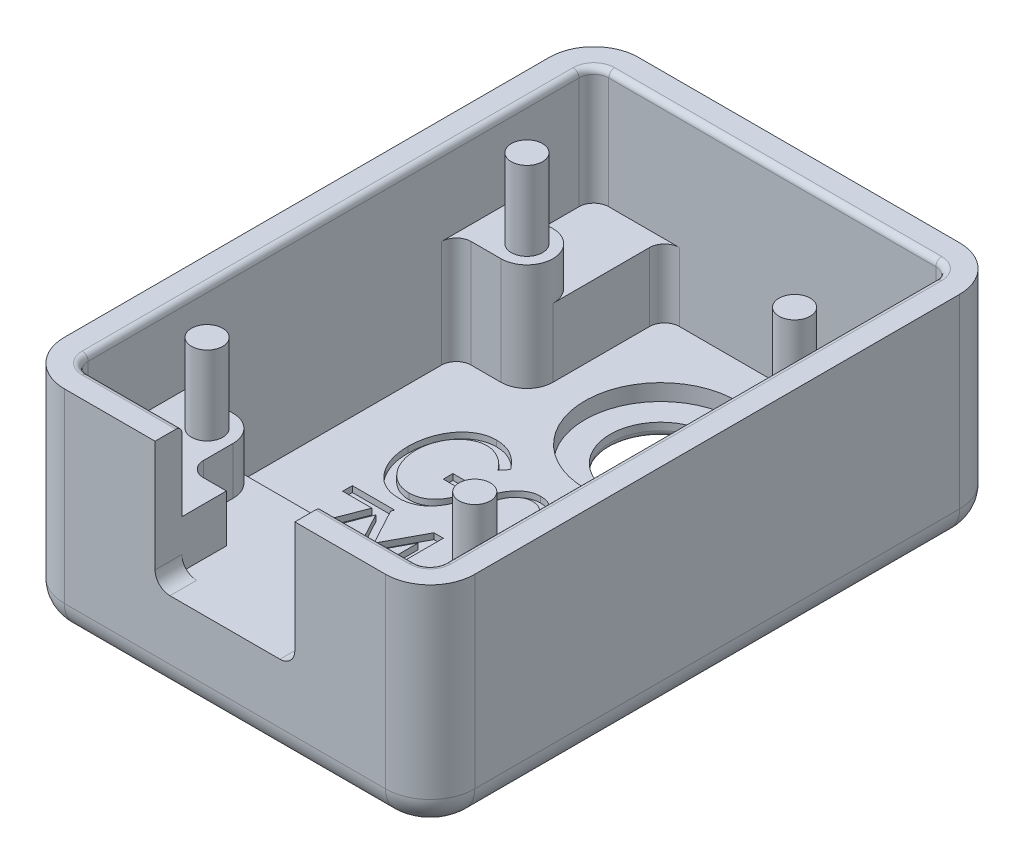
from build123d import *

# Parameters (mm, degrees)
SKETCH_1_3_W        = 27.6
SKETCH_1_3_H        = 38.61
EXTRUDE_2_DEPTH     = 5.3
SKETCH_1_3_R        = 1.05
EXTRUDE_2_2_DEPTH   = 5.3
EXTRUDE_2_3_DEPTH   = 5.3
EXTRUDE_2_4_DEPTH   = 5.3
EXTRUDE_2_5_DEPTH   = 5.3
EXTRUDE_START       = -7.2
SKETCH_1_W          = 27.6
SKETCH_1_H          = 38.61
EXTRUDE_3_DEPTH     = 7.2
EXTRUDE_START_2     = -8.1
EXTRUDE_4_DEPTH     = 4.9
CUT_EXTRUDE_1_DEPTH = 2.3
SKETCH_1_6_W        = 27.6
SKETCH_1_6_H        = 38.61
EXTRUDE_5_DEPTH     = 2
EXTRUDE_6_DEPTH     = 4.6
FILLET_1_R          = 3
FILLET_3_R          = 2
SKETCH_3_7_R        = 3.4
CUT_EXTRUDE_2_DEPTH = 3
SKETCH_3_8_R        = 5.1
SKETCH_3_8_R_2      = 3.4
CUT_EXTRUDE_3_DEPTH = 1.1
FILLET_4_R          = 0.4
FILLET_5_R          = 0.4
CUT_EXTRUDE_4_DEPTH = 0.4
CUT_EXTRUDE_5_DEPTH = 0.4


with BuildPart() as part:
    # 草图1<3> → 凸台-拉伸2 (new body)
    with BuildSketch(Plane(origin=(0, 0, 0), x_dir=(1, 0, 0), z_dir=(0, 1, 0))):
        with Locations((0, 0.75)):
            Rectangle(SKETCH_1_3_W, SKETCH_1_3_H)
        with BuildLine():
            ThreePointArc((-12, 17.255), (-11.707106781, 17.962106781), (-11, 18.255))
            Line((-11, 18.255), (11, 18.255))
            ThreePointArc((11, 18.255), (11.707106781, 17.962106781), (12, 17.255))
            Line((12, 17.255), (12, -15.755))
            ThreePointArc((12, -15.755), (11.707106781, -16.462106781), (11, -16.755))
            Line((11, -16.755), (-11, -16.755))
            ThreePointArc((-11, -16.755), (-11.707106781, -16.462106781), (-12, -15.755))
            Line((-12, -15.755), (-12, 17.255))
        make_face(mode=Mode.SUBTRACT)
    extrude(amount=EXTRUDE_2_DEPTH)

    # 草图1 → 凸台-拉伸3 (add)
    with BuildSketch(Plane(origin=(0, 0, 0), x_dir=(1, 0, 0), z_dir=(0, 1, 0)).offset(EXTRUDE_START)):
        with Locations((0, 0.75)):
            Rectangle(SKETCH_1_W, SKETCH_1_H)
        with BuildLine():
            ThreePointArc((-12, 17.255), (-11.707106781, 17.962106781), (-11, 18.255))
            Line((-11, 18.255), (11, 18.255))
            ThreePointArc((11, 18.255), (11.707106781, 17.962106781), (12, 17.255))
            Line((12, 17.255), (12, 13.505))
            ThreePointArc((12, 13.505), (11.707106781, 12.797893219), (11, 12.505))
            Line((11, 12.505), (9, 12.505))
            ThreePointArc((9, 12.505), (7.25, 10.755), (9, 9.005))
            Line((9, 9.005), (11, 9.005))
            ThreePointArc((11, 9.005), (11.707106781, 8.712106781), (12, 8.005))
            Line((12, 8.005), (12, -8.005))
            ThreePointArc((12, -8.005), (11.707106781, -8.712106781), (11, -9.005))
            Line((11, -9.005), (9, -9.005))
            ThreePointArc((9, -9.005), (7.762563133, -9.517563133), (7.25, -10.755))
            Line((7.25, -10.755), (7.25, -12.755))
            ThreePointArc((7.25, -12.755), (6.957106781, -13.462106781), (6.25, -13.755))
            Line((6.25, -13.755), (4.7, -13.755))
            Line((4.7, -13.755), (4.7, -16.755))
            Line((4.7, -16.755), (-4.7, -16.755))
            Line((-4.7, -16.755), (-4.7, -13.755))
            Line((-4.7, -13.755), (-6.25, -13.755))
            ThreePointArc((-6.25, -13.755), (-6.957106781, -13.462106781), (-7.25, -12.755))
            Line((-7.25, -12.755), (-7.25, -10.755))
            ThreePointArc((-7.25, -10.755), (-7.762563133, -9.517563133), (-9, -9.005))
            Line((-9, -9.005), (-11, -9.005))
            ThreePointArc((-11, -9.005), (-11.707106781, -8.712106781), (-12, -8.005))
            Line((-12, -8.005), (-12, 8.005))
            ThreePointArc((-12, 8.005), (-11.707106781, 8.712106781), (-11, 9.005))
            Line((-11, 9.005), (-9, 9.005))
            ThreePointArc((-9, 9.005), (-7.25, 10.755), (-9, 12.505))
            Line((-9, 12.505), (-11, 12.505))
            ThreePointArc((-11, 12.505), (-11.707106781, 12.797893219), (-12, 13.505))
            Line((-12, 13.505), (-12, 17.255))
        make_face(mode=Mode.SUBTRACT)
    extrude(amount=EXTRUDE_3_DEPTH)

    # 草图1<5> → 凸台-拉伸4 (add)
    with BuildSketch(Plane(origin=(0, 0, 0), x_dir=(1, 0, 0), z_dir=(0, 1, 0)).offset(EXTRUDE_START_2)):
        with BuildLine():
            Line((9, -9.005), (-9, -9.005))
            ThreePointArc((-9, -9.005), (-7.762563133, -9.517563133), (-7.25, -10.755))
            Line((-7.25, -10.755), (-7.25, -12.755))
            ThreePointArc((-7.25, -12.755), (-6.957106781, -13.462106781), (-6.25, -13.755))
            Line((-6.25, -13.755), (-4.7, -13.755))
            Line((-4.7, -13.755), (-4.7, -16.755))
            Line((-4.7, -16.755), (4.7, -16.755))
            Line((4.7, -16.755), (4.7, -13.755))
            Line((4.7, -13.755), (6.25, -13.755))
            ThreePointArc((6.25, -13.755), (6.957106781, -13.462106781), (7.25, -12.755))
            Line((7.25, -12.755), (7.25, -10.755))
            ThreePointArc((7.25, -10.755), (7.762563133, -9.517563133), (9, -9.005))
        make_face()
    extrude(amount=EXTRUDE_4_DEPTH)

    # 草图2 → 切除-拉伸1 (cut)
    with BuildSketch(Plane.XY.offset(18.555)):
        with BuildLine():
            Line((-4.7, 5.3), (-4.7, -2.2))
            ThreePointArc((-4.7, -2.2), (-4.407106781, -2.907106781), (-3.7, -3.2))
            Line((-3.7, -3.2), (3.7, -3.2))
            ThreePointArc((3.7, -3.2), (4.407106781, -2.907106781), (4.7, -2.2))
            Line((4.7, -2.2), (4.7, 5.3))
            Line((4.7, 5.3), (-4.7, 5.3))
        make_face()
    extrude(amount=-CUT_EXTRUDE_1_DEPTH, mode=Mode.SUBTRACT)

    # 草图1<6> → 凸台-拉伸5 (add)
    with BuildSketch(Plane(origin=(0, 0, 0), x_dir=(1, 0, 0), z_dir=(0, 1, 0)).offset(EXTRUDE_START)):
        with Locations((0, 0.75)):
            Rectangle(SKETCH_1_6_W, SKETCH_1_6_H)
    extrude(amount=-EXTRUDE_5_DEPTH)

    # 草图3 → 凸台-拉伸6 (add)
    with BuildSketch(Plane(origin=(0, -7.2, 0), x_dir=(1, 0, 0), z_dir=(0, 1, 0))):
        with BuildLine():
            Line((11, 18.255), (6.25, 18.255))
            ThreePointArc((6.25, 18.255), (6.957106781, 17.962106781), (7.25, 17.255))
            Line((7.25, 17.255), (7.25, 10.755))
            ThreePointArc((7.25, 10.755), (7.762563133, 11.992436867), (9, 12.505))
            Line((9, 12.505), (11, 12.505))
            ThreePointArc((11, 12.505), (11.707106781, 12.797893219), (12, 13.505))
            Line((12, 13.505), (12, 17.255))
            ThreePointArc((12, 17.255), (11.707106781, 17.962106781), (11, 18.255))
        make_face()
        with BuildLine():
            Line((-6.25, 18.255), (-11, 18.255))
            ThreePointArc((-11, 18.255), (-11.707106781, 17.962106781), (-12, 17.255))
            Line((-12, 17.255), (-12, 13.505))
            ThreePointArc((-12, 13.505), (-11.707106781, 12.797893219), (-11, 12.505))
            Line((-11, 12.505), (-9, 12.505))
            ThreePointArc((-9, 12.505), (-7.762563133, 11.992436867), (-7.25, 10.755))
            Line((-7.25, 10.755), (-7.25, 17.255))
            ThreePointArc((-7.25, 17.255), (-6.957106781, 17.962106781), (-6.25, 18.255))
        make_face()
    extrude(amount=EXTRUDE_6_DEPTH)

    # 圆角1
    fillet_1_edges = [part.edges().sort_by_distance(p)[0] for p in [
        (-13.8, -1.95, -20.055),
        (13.8, -1.95, -20.055),
        (13.8, -1.95, 18.555),
        (-13.8, -1.95, 18.555),
    ]]
    fillet(fillet_1_edges, radius=FILLET_1_R)

    # 圆角3
    fillet_3_edges = [part.edges().sort_by_distance(p)[0] for p in [
        (12.921320344, -9.2, 17.676320344),
        (0, -9.2, 18.555),
        (-12.921320344, -9.2, 17.676320344),
        (-13.8, -9.2, -0.75),
        (-12.921320344, -9.2, -19.176320344),
        (0, -9.2, -20.055),
        (12.921320344, -9.2, -19.176320344),
        (13.8, -9.2, -0.75),
    ]]
    fillet(fillet_3_edges, radius=FILLET_3_R)

    # 草图3<7> → 切除-拉伸2 (cut)
    with BuildSketch(Plane(origin=(0, -7.2, 0), x_dir=(1, 0, 0), z_dir=(0, 1, 0))):
        with Locations((0, 10.755)):
            Circle(SKETCH_3_7_R)
    extrude(amount=-CUT_EXTRUDE_2_DEPTH, mode=Mode.SUBTRACT)

    # 草图3<8> → 切除-拉伸3 (cut)
    with BuildSketch(Plane(origin=(0, -7.2, 0), x_dir=(1, 0, 0), z_dir=(0, 1, 0))):
        with Locations((0, 10.755)):
            Circle(SKETCH_3_8_R)
        with Locations((0, 10.755)):
            Circle(SKETCH_3_8_R_2, mode=Mode.SUBTRACT)
    extrude(amount=-CUT_EXTRUDE_3_DEPTH, mode=Mode.SUBTRACT)

    # 圆角4
    fillet_4_edges = [part.edges().sort_by_distance(p)[0] for p in [
        (-3.4, -9.2, -10.755),
    ]]
    fillet(fillet_4_edges, radius=FILLET_4_R)

    # 圆角5
    fillet_5_edges = [part.edges().sort_by_distance(p)[0] for p in [
        (-11.707106781, 5.3, -17.962106781),
        (0, 5.3, -18.255),
        (11.707106781, 5.3, -17.962106781),
        (12, 5.3, -0.75),
        (11.707106781, 5.3, 16.462106781),
        (-7.85, 5.3, 16.755),
        (7.85, 5.3, 16.755),
        (-11.707106781, 5.3, 16.462106781),
        (-12, 5.3, -0.75),
    ]]
    fillet(fillet_5_edges, radius=FILLET_5_R)

    # 草图4 → 切除-拉伸4 (cut)
    # profile 1 of 4: a face of its own
    with BuildSketch(Plane(origin=(0, -7.2, 0), x_dir=(1, 0, 0), z_dir=(0, 1, 0))):
        with BuildLine():
            Line((-3.590091151, 4.248976752), (-3.970429693, 3.785955919))
            add(Edge.make_bspline(
                [(-3.970429693, 3.785955919), (-4.037268914, 3.86860631), (-4.167484556, 4.029625147), (-4.381793299, 4.244574793), (-4.606978121, 4.42652171), (-4.839336209, 4.576328742), (-5.073951621, 4.695723028), (-5.308514002, 4.780175703), (-5.540173518, 4.834597756), (-5.694606155, 4.841099815), (-5.770359581, 4.844289252)],
                knots=[0, 0, 0, 0, 1.180897879, 2.300615913, 3.366389015, 4.392591617, 5.368437861, 6.285267508, 7.158876892, 8, 8, 8, 8], degree=3))
            add(Edge.make_bspline(
                [(-5.770359581, 4.844289252), (-5.817069945, 4.843567106), (-5.909994566, 4.842130484), (-6.048046267, 4.822645863), (-6.18438916, 4.795524642), (-6.31903187, 4.755150037), (-6.452367609, 4.704696653), (-6.58392555, 4.641603985), (-6.713832151, 4.568021811), (-6.840173578, 4.482402267), (-6.963641544, 4.389426747), (-7.079108807, 4.28543502), (-7.189354106, 4.175084641), (-7.2907077, 4.054715547), (-7.386409498, 3.92769037), (-7.474681051, 3.792279004), (-7.55431217, 3.648079314), (-7.652350453, 3.447323234), (-7.754299715, 3.185363029), (-7.840173571, 2.859713522), (-7.894588505, 2.525493885), (-7.90140157, 2.299577239), (-7.904834741, 2.185735566)],
                knots=[0, 0, 0, 0, 0.742195851, 1.476508881, 2.213078346, 2.951281721, 3.708907221, 4.477997883, 5.269176095, 6.080806104, 6.903452709, 7.724910218, 8.549764533, 9.38205395, 10.224901256, 11.077722799, 11.950072611, 12.842695263, 14.629531552, 16.409024752, 18.190471412, 20, 20, 20, 20], degree=3))
            add(Edge.make_bspline(
                [(-7.904834741, 2.185735566), (-7.903766457, 2.127195017), (-7.901634663, 2.01037557), (-7.887242044, 1.836286362), (-7.864388761, 1.664337229), (-7.832765514, 1.49432663), (-7.790496159, 1.326733211), (-7.73964663, 1.161107644), (-7.679681635, 0.998088531), (-7.611368043, 0.838221313), (-7.534536244, 0.683742681), (-7.448589141, 0.537368493), (-7.357921101, 0.398559622), (-7.258451158, 0.26923917), (-7.154090381, 0.14679802), (-7.03961983, 0.035119282), (-6.920265073, -0.07000666), (-6.793335829, -0.165000161), (-6.661123655, -0.249616486), (-6.526473689, -0.325825656), (-6.387304238, -0.387842756), (-6.245178796, -0.43878873), (-6.100514493, -0.480333525), (-5.952152984, -0.507192999), (-5.801405472, -0.526682916), (-5.699614565, -0.528081735), (-5.648244196, -0.528787671)],
                knots=[0, 0, 0, 0, 1.075648671, 2.146489633, 3.207621231, 4.262009588, 5.322110962, 6.381840063, 7.444229469, 8.512289095, 9.575021281, 10.611993966, 11.629793255, 12.619316909, 13.608073431, 14.583229653, 15.555112222, 16.529022636, 17.492908616, 18.438097579, 19.369212982, 20.288485365, 21.211020687, 22.130920189, 23.056739734, 24, 24, 24, 24], degree=3))
            add(Edge.make_bspline(
                [(-5.648244196, -0.528787671), (-5.586245073, -0.527056469), (-5.464260062, -0.52365028), (-5.285344173, -0.49735207), (-5.113659215, -0.455986559), (-4.949846036, -0.395188367), (-4.792865222, -0.318806283), (-4.64289298, -0.22542814), (-4.501546978, -0.113861253), (-4.368342058, 0.013130948), (-4.24564184, 0.153900711), (-4.134540487, 0.305821463), (-4.036580785, 0.467497625), (-3.951668914, 0.63919933), (-3.88250654, 0.821470317), (-3.824955576, 1.013552652), (-3.779918292, 1.215435345), (-3.762002753, 1.35449423), (-3.752911664, 1.425058483)],
                knots=[0, 0, 0, 0, 0.992732885, 1.953229764, 2.890514293, 3.816609624, 4.746085783, 5.682705685, 6.640557555, 7.625359646, 8.626536552, 9.627713458, 10.636418116, 11.650913816, 12.691491505, 13.75510899, 14.860849082, 16, 16, 16, 16], degree=3))
            Line((-3.752911664, 1.425058483), (-5.299706536, 1.425058483))
            Line((-5.299706536, 1.425058483), (-5.299706536, 2.076340534))
            Line((-5.299706536, 2.076340534), (-3.264450126, 2.076340534))
            add(Edge.make_bspline(
                [(-3.264450126, 2.076340534), (-3.266781118, 1.955008717), (-3.271337241, 1.717855355), (-3.30292307, 1.371781229), (-3.356675444, 1.045124129), (-3.428382129, 0.73736964), (-3.521287099, 0.448796583), (-3.634098973, 0.179333085), (-3.768732371, -0.070444666), (-3.921541226, -0.300040806), (-4.091896723, -0.506543018), (-4.276761073, -0.687428033), (-4.476488804, -0.840312635), (-4.690886839, -0.964489286), (-4.91879673, -1.062183294), (-5.160784992, -1.130508252), (-5.416559495, -1.172251665), (-5.591688729, -1.177423075), (-5.681317113, -1.180069722)],
                knots=[0, 0, 0, 0, 1.279979538, 2.501828927, 3.662287385, 4.770080211, 5.832462613, 6.856844025, 7.847542677, 8.821456207, 9.761900772, 10.666623651, 11.544302252, 12.408204966, 13.273981784, 14.15325484, 15.054864909, 16, 16, 16, 16], degree=3))
            add(Edge.make_bspline(
                [(-5.681317113, -1.180069722), (-5.736047147, -1.179032528), (-5.844411972, -1.176978896), (-6.004923252, -1.162407979), (-6.161470815, -1.140313842), (-6.31335342, -1.106461196), (-6.461176263, -1.065212624), (-6.604063975, -1.012326059), (-6.742954782, -0.951146361), (-6.878249429, -0.881607377), (-7.008047049, -0.800587196), (-7.134123982, -0.711839898), (-7.255622578, -0.613198839), (-7.372344567, -0.505173345), (-7.484906099, -0.387482415), (-7.592528611, -0.259980243), (-7.697419806, -0.124307777), (-7.761657679, -0.028005722), (-7.794167674, 0.02073156)],
                knots=[0, 0, 0, 0, 1.032382545, 2.044105334, 3.038476821, 4.012827536, 4.97754274, 5.931586725, 6.884288403, 7.839538852, 8.798533035, 9.768407888, 10.746592774, 11.748528567, 12.766901797, 13.816738798, 14.895078446, 16, 16, 16, 16], degree=3))
            add(Edge.make_bspline(
                [(-7.794167674, 0.02073156), (-7.842070399, 0.098461677), (-7.937948178, 0.254039276), (-8.058923312, 0.50003576), (-8.163191374, 0.754348296), (-8.246465546, 1.018404565), (-8.313187602, 1.291103885), (-8.359771065, 1.573014544), (-8.388631595, 1.863726409), (-8.391727942, 2.060584082), (-8.39329628, 2.160294861)],
                knots=[0, 0, 0, 0, 0.972045947, 1.945559608, 2.915893918, 3.89712903, 4.891732452, 5.90371772, 6.93820781, 8, 8, 8, 8], degree=3))
            add(Edge.make_bspline(
                [(-8.39329628, 2.160294861), (-8.392451829, 2.234954934), (-8.390775196, 2.383190373), (-8.373270186, 2.603470806), (-8.347053144, 2.81960006), (-8.309625772, 3.031772089), (-8.263445687, 3.240163877), (-8.203806916, 3.444410063), (-8.136109113, 3.645356183), (-8.055391689, 3.840605458), (-7.967459744, 4.029071744), (-7.870596898, 4.208171217), (-7.764702464, 4.376063968), (-7.651863057, 4.53413171), (-7.53041819, 4.680923639), (-7.401656204, 4.817295062), (-7.265607937, 4.944087875), (-7.12033551, 5.058014324), (-6.969780032, 5.160972184), (-6.813911609, 5.250781522), (-6.652462032, 5.326024261), (-6.486816959, 5.388501847), (-6.315507728, 5.435758856), (-6.139855789, 5.469636632), (-5.95922769, 5.492656711), (-5.837000755, 5.494595125), (-5.775447722, 5.495571304)],
                knots=[0, 0, 0, 0, 1.139613768, 2.262670523, 3.371514243, 4.462374492, 5.550696422, 6.628397115, 7.709281568, 8.786379394, 9.852056274, 10.883259988, 11.892634097, 12.880693113, 13.846294527, 14.798787622, 15.742440682, 16.682668171, 17.614523987, 18.525044925, 19.425686334, 20.331084297, 21.224742707, 22.135010483, 23.060798158, 24, 24, 24, 24], degree=3))
            add(Edge.make_bspline(
                [(-5.775447722, 5.495571304), (-5.725383776, 5.494496672), (-5.625489871, 5.49235243), (-5.477201823, 5.478099441), (-5.331113948, 5.454983497), (-5.186908273, 5.423401574), (-5.045034817, 5.381459932), (-4.905502899, 5.329896015), (-4.767841932, 5.270537545), (-4.632559066, 5.199885023), (-4.498786941, 5.119565977), (-4.365867984, 5.028649612), (-4.233632184, 4.926925793), (-4.102524442, 4.813406033), (-3.972671032, 4.688106981), (-3.843404932, 4.5521638), (-3.714229192, 4.405809876), (-3.632018206, 4.301946422), (-3.590091151, 4.248976752)],
                knots=[0, 0, 0, 0, 0.919647238, 1.834996262, 2.733959633, 3.635416665, 4.54488085, 5.449260826, 6.366695346, 7.296870797, 8.250651732, 9.231496765, 10.253508801, 11.31380595, 12.415577929, 13.567028811, 14.759200909, 16, 16, 16, 16], degree=3))
        make_face()
    # profile 2 of 4: a face of its own
    with BuildSketch(Plane(origin=(0, -7.2, 0), x_dir=(1, 0, 0), z_dir=(0, 1, 0))):
        with BuildLine():
            Line((0.879331925, 3.623135406), (0.879331925, -1.017249209))
            Line((0.879331925, -1.017249209), (0.390870387, -1.017249209))
            Line((0.390870387, -1.017249209), (0.390870387, -0.214594962))
            add(Edge.make_bspline(
                [(0.390870387, -0.214594962), (0.343290975, -0.287014469), (0.251424081, -0.426842911), (0.092303488, -0.610218588), (-0.073453002, -0.765929992), (-0.250453108, -0.888869718), (-0.435944268, -0.983343097), (-0.6296653, -1.049061496), (-0.83133923, -1.092356556), (-0.969134264, -1.096540975), (-1.038897241, -1.098659466)],
                knots=[0, 0, 0, 0, 1.179334017, 2.277072125, 3.299058578, 4.27014761, 5.202761405, 6.125302315, 7.050876602, 8, 8, 8, 8], degree=3))
            add(Edge.make_bspline(
                [(-1.038897241, -1.098659466), (-1.100952596, -1.096416644), (-1.22383303, -1.091975464), (-1.404198481, -1.057802363), (-1.577344399, -1.003029541), (-1.743493877, -0.925394245), (-1.90264162, -0.82569678), (-2.054726902, -0.703784918), (-2.199179781, -0.559702853), (-2.334832881, -0.396005034), (-2.458070123, -0.216202282), (-2.568757669, -0.026515482), (-2.660205622, 0.174486433), (-2.73529728, 0.384750386), (-2.79373613, 0.604321612), (-2.836056366, 0.833044045), (-2.859899157, 1.071348908), (-2.86363952, 1.233354167), (-2.865539869, 1.315663451)],
                knots=[0, 0, 0, 0, 0.887872522, 1.758142578, 2.618128085, 3.481683386, 4.376005731, 5.300250685, 6.265959025, 7.291808604, 8.339055305, 9.383289759, 10.431679196, 11.495297482, 12.575994128, 13.680797244, 14.821693069, 16, 16, 16, 16], degree=3))
            add(Edge.make_bspline(
                [(-2.865539869, 1.315663451), (-2.863771066, 1.39629116), (-2.860280395, 1.555407094), (-2.834424723, 1.789329643), (-2.792285438, 2.01467106), (-2.734515506, 2.231243732), (-2.657442114, 2.438247016), (-2.564018744, 2.636397535), (-2.454856436, 2.826153505), (-2.329612166, 3.004469256), (-2.192463276, 3.167041333), (-2.047062975, 3.310944374), (-1.894305286, 3.432774912), (-1.733634423, 3.531174844), (-1.567483356, 3.610442385), (-1.393219689, 3.665086002), (-1.211834781, 3.697574266), (-1.088639102, 3.702200226), (-1.026176889, 3.704545663)],
                knots=[0, 0, 0, 0, 1.159290559, 2.287818926, 3.379660878, 4.453494628, 5.506844558, 6.551511375, 7.600493292, 8.650980421, 9.680735975, 10.655174849, 11.588394672, 12.48356998, 13.359156398, 14.228863471, 15.102004974, 16, 16, 16, 16], degree=3))
            add(Edge.make_bspline(
                [(-1.026176889, 3.704545663), (-0.954754791, 3.701868926), (-0.813612809, 3.696579249), (-0.60742068, 3.65417466), (-0.412961827, 3.58091152), (-0.227567357, 3.48293381), (-0.053186812, 3.35184523), (0.107907984, 3.186992113), (0.259916545, 2.990347672), (0.345960719, 2.841960444), (0.390870387, 2.764511608)],
                knots=[0, 0, 0, 0, 0.955142924, 1.887521798, 2.80119314, 3.727598216, 4.684104897, 5.707064902, 6.803231533, 8, 8, 8, 8], degree=3))
            Line((0.390870387, 2.764511608), (0.390870387, 3.623135406))
            Line((0.390870387, 3.623135406), (0.879331925, 3.623135406))
        make_face()
        with BuildLine():
            add(Edge.make_bspline(
                [(-0.991831937, 3.134673868), (-1.053577402, 3.131688354), (-1.176152967, 3.125761586), (-1.355786203, 3.079467826), (-1.526942317, 3.002670007), (-1.689583518, 2.89824055), (-1.840407797, 2.766207148), (-1.975213772, 2.608467483), (-2.094704002, 2.427003081), (-2.194189366, 2.223919856), (-2.275550729, 2.00621433), (-2.333481328, 1.77932784), (-2.371021725, 1.546301226), (-2.375048347, 1.388737519), (-2.377078331, 1.309303275)],
                knots=[0, 0, 0, 0, 0.876143593, 1.739298532, 2.615462818, 3.5308531, 4.474045836, 5.451821009, 6.468949931, 7.55154866, 8.656673038, 9.763764415, 10.872623107, 12, 12, 12, 12], degree=3))
            add(Edge.make_bspline(
                [(-2.377078331, 1.309303275), (-2.37499236, 1.230304301), (-2.370843676, 1.073187207), (-2.333896402, 0.840328296), (-2.273633419, 0.612981171), (-2.192145855, 0.393584202), (-2.09027208, 0.18925493), (-1.971909183, 0.005226564), (-1.836193206, -0.154391126), (-1.684636346, -0.287882797), (-1.522915389, -0.395664309), (-1.3520855, -0.47154659), (-1.175568374, -0.520218084), (-1.054894517, -0.525925416), (-0.994376007, -0.528787671)],
                knots=[0, 0, 0, 0, 1.119778423, 2.227071088, 3.334118807, 4.451051948, 5.540186051, 6.565939309, 7.546896586, 8.501209795, 9.421850429, 10.291284033, 11.143070857, 12, 12, 12, 12], degree=3))
            add(Edge.make_bspline(
                [(-0.994376007, -0.528787671), (-0.933465882, -0.525784934), (-0.811715179, -0.519782888), (-0.632066905, -0.472763892), (-0.457582573, -0.397285181), (-0.291866623, -0.290190776), (-0.13573401, -0.161125008), (0.001236144, -0.005731172), (0.120249644, 0.169191026), (0.217736952, 0.365093531), (0.295033077, 0.577676112), (0.350709804, 0.80452172), (0.384399643, 1.044560001), (0.388678806, 1.208701464), (0.390870387, 1.292766816)],
                knots=[0, 0, 0, 0, 0.862570292, 1.724155687, 2.61524019, 3.547403977, 4.511725999, 5.478125195, 6.473421915, 7.502977832, 8.571655993, 9.673787814, 10.808626144, 12, 12, 12, 12], degree=3))
            add(Edge.make_bspline(
                [(0.390870387, 1.292766816), (0.38972766, 1.356846471), (0.38748236, 1.482754057), (0.367472027, 1.667568336), (0.337703051, 1.84460613), (0.29463035, 2.013819984), (0.236692875, 2.174210723), (0.168256124, 2.327129988), (0.087777482, 2.472390076), (-0.005646839, 2.607033634), (-0.108268589, 2.729609314), (-0.215799732, 2.83907424), (-0.331204274, 2.929832864), (-0.452010923, 3.004362959), (-0.578306732, 3.064185322), (-0.711859926, 3.103785234), (-0.849942384, 3.131159248), (-0.94420643, 3.133494179), (-0.991831937, 3.134673868)],
                knots=[0, 0, 0, 0, 1.20221804, 2.362190828, 3.48462824, 4.569282157, 5.633932456, 6.681042011, 7.71052723, 8.745747275, 9.751336919, 10.707874985, 11.620059176, 12.498976955, 13.367640915, 14.233493954, 15.107499117, 16, 16, 16, 16], degree=3))
        make_face(mode=Mode.SUBTRACT)
    # profile 3 of 4: a face of its own
    with BuildSketch(Plane(origin=(0, -7.2, 0), x_dir=(1, 0, 0), z_dir=(0, 1, 0))):
        Polygon((3.557729361, 5.332750791), (5.674396028, -1.017249209), (5.142685291, -1.017249209), (4.464690499, 1.018007201), (2.569357967, 1.018007201), (1.891363175, -1.017249209), (1.359652438, -1.017249209), (3.476319105, 5.332750791), align=None)
        Polygon((3.517024233, 3.859733964), (2.786875996, 1.669289252), (4.24717247, 1.669289252), align=None, mode=Mode.SUBTRACT)
    # profile 4 of 4: a face of its own
    with BuildSketch(Plane(origin=(0, -7.2, 0), x_dir=(1, 0, 0), z_dir=(0, 1, 0))):
        with BuildLine():
            Line((8.108562695, 3.044359364), (7.808362374, 2.646212329))
            add(Edge.make_bspline(
                [(7.808362374, 2.646212329), (7.778811385, 2.684825088), (7.722070481, 2.758965509), (7.631516817, 2.858561783), (7.54133607, 2.942885643), (7.452136293, 3.012225594), (7.363516987, 3.067360151), (7.274253929, 3.105398343), (7.18552821, 3.130044506), (7.126274949, 3.133153355), (7.097294666, 3.134673868)],
                knots=[0, 0, 0, 0, 1.306439345, 2.508496321, 3.613260685, 4.620812336, 5.541400319, 6.409338993, 7.222020771, 8, 8, 8, 8], degree=3))
            add(Edge.make_bspline(
                [(7.097294666, 3.134673868), (7.061786644, 3.132617265), (6.991031373, 3.128519163), (6.889956184, 3.090719378), (6.797157848, 3.030328041), (6.716406218, 2.947725637), (6.648788573, 2.851281834), (6.597451861, 2.745092462), (6.567697065, 2.630004126), (6.563768102, 2.550553678), (6.561767823, 2.510104557)],
                knots=[0, 0, 0, 0, 0.934124342, 1.861388436, 2.807960774, 3.836490042, 4.888784344, 5.904760768, 6.933290036, 8, 8, 8, 8], degree=3))
            add(Edge.make_bspline(
                [(6.561767823, 2.510104557), (6.562916179, 2.473444742), (6.56520179, 2.400479513), (6.593716659, 2.293733619), (6.631494701, 2.187549301), (6.671204347, 2.122389466), (6.691515419, 2.089060887)],
                knots=[0, 0, 0, 0, 0.98233681, 1.955177088, 2.954094317, 4, 4, 4, 4], degree=3))
            add(Edge.make_bspline(
                [(6.691515419, 2.089060887), (6.718658588, 2.053140727), (6.779106746, 1.973146105), (6.900236674, 1.858316152), (7.056691465, 1.7359371), (7.174814687, 1.654613953), (7.238490579, 1.61077563)],
                knots=[0, 0, 0, 0, 0.738585845, 1.644839412, 2.730419391, 4, 4, 4, 4], degree=3))
            add(Edge.make_bspline(
                [(7.238490579, 1.61077563), (7.279379365, 1.583056251), (7.358666382, 1.529305892), (7.471114589, 1.446669831), (7.572659219, 1.363935158), (7.664894189, 1.282608939), (7.746300712, 1.201678828), (7.816807161, 1.120574472), (7.878401186, 1.041194712), (7.912675547, 0.986076522), (7.929205724, 0.959493579)],
                knots=[0, 0, 0, 0, 1.238629189, 2.401812918, 3.497745539, 4.521965825, 5.484274402, 6.373439073, 7.215526201, 8, 8, 8, 8], degree=3))
            add(Edge.make_bspline(
                [(7.929205724, 0.959493579), (7.957129919, 0.905496209), (8.013127857, 0.797212287), (8.068009095, 0.620569307), (8.102070501, 0.434626052), (8.10637025, 0.307094255), (8.108562695, 0.242065695)],
                knots=[0, 0, 0, 0, 0.974315763, 1.953849418, 2.956666258, 4, 4, 4, 4], degree=3))
            add(Edge.make_bspline(
                [(8.108562695, 0.242065695), (8.10765218, 0.196222845), (8.105859661, 0.105972583), (8.089706438, -0.026602254), (8.066283511, -0.153992138), (8.031667921, -0.276336716), (7.985816815, -0.392735366), (7.930612417, -0.504018246), (7.86713986, -0.610841515), (7.792243616, -0.709543461), (7.712017849, -0.801692149), (7.623881364, -0.880330462), (7.531476788, -0.947462769), (7.434164477, -1.002445025), (7.33197329, -1.046272785), (7.224257889, -1.076804193), (7.11147108, -1.094828304), (7.034606468, -1.097368262), (6.995531845, -1.098659466)],
                knots=[0, 0, 0, 0, 1.133585308, 2.231675631, 3.299337233, 4.335252331, 5.371485992, 6.389402436, 7.405750482, 8.439964918, 9.450396182, 10.423385841, 11.354957436, 12.270867247, 13.182623524, 14.098953656, 15.033590804, 16, 16, 16, 16], degree=3))
            add(Edge.make_bspline(
                [(6.995531845, -1.098659466), (6.94277816, -1.096874147), (6.83798458, -1.093327667), (6.683298227, -1.059338592), (6.532368595, -1.007203469), (6.386357648, -0.934320289), (6.247962664, -0.843837882), (6.123007486, -0.733316128), (6.006830521, -0.610967724), (5.942784345, -0.517440137), (5.910485772, -0.470274049)],
                knots=[0, 0, 0, 0, 0.967547107, 1.922002665, 2.894705894, 3.894125815, 4.911314726, 5.921445556, 6.951782191, 8, 8, 8, 8], degree=3))
            Line((5.910485772, -0.470274049), (6.204325916, -0.040326132))
            add(Edge.make_bspline(
                [(6.204325916, -0.040326132), (6.233395203, -0.078982077), (6.289355848, -0.153397783), (6.380043032, -0.252977624), (6.471655101, -0.337758036), (6.564874023, -0.407160714), (6.659834456, -0.461862842), (6.756757508, -0.499858466), (6.854823672, -0.524385495), (6.920767327, -0.527325762), (6.953554682, -0.528787671)],
                knots=[0, 0, 0, 0, 1.249338816, 2.405074618, 3.475318477, 4.470274505, 5.402622068, 6.297918227, 7.153720577, 8, 8, 8, 8], degree=3))
            add(Edge.make_bspline(
                [(6.953554682, -0.528787671), (6.998436552, -0.526239271), (7.086876098, -0.521217659), (7.212922327, -0.47682722), (7.328423897, -0.405916864), (7.428692929, -0.308240411), (7.514198704, -0.193599658), (7.575634445, -0.065279271), (7.61277668, 0.073378511), (7.61761809, 0.168903885), (7.620101156, 0.217897025)],
                knots=[0, 0, 0, 0, 0.968532431, 1.908489313, 2.855670908, 3.880935283, 4.917628117, 5.935229783, 6.941018784, 8, 8, 8, 8], degree=3))
            add(Edge.make_bspline(
                [(7.620101156, 0.217897025), (7.61878837, 0.258308075), (7.616207006, 0.337769295), (7.59124507, 0.453160399), (7.550580515, 0.561830859), (7.511316282, 0.627588423), (7.491625595, 0.660565294)],
                knots=[0, 0, 0, 0, 1.036106089, 2.037320308, 3.015732467, 4, 4, 4, 4], degree=3))
            add(Edge.make_bspline(
                [(7.491625595, 0.660565294), (7.479661379, 0.676953625), (7.453705603, 0.712507302), (7.404462112, 0.7633787), (7.347587485, 0.819822857), (7.279612013, 0.878476705), (7.200829318, 0.938686265), (7.112499521, 1.002586372), (7.014506981, 1.069997105), (6.945175023, 1.11525722), (6.909033448, 1.13885055)],
                knots=[0, 0, 0, 0, 0.64195079, 1.392680575, 2.237883628, 3.180341081, 4.233334277, 5.377678955, 6.633028461, 8, 8, 8, 8], degree=3))
            add(Edge.make_bspline(
                [(6.909033448, 1.13885055), (6.833329183, 1.19086807), (6.690668337, 1.288892446), (6.505325684, 1.448589621), (6.355590564, 1.605410507), (6.282940927, 1.719012011), (6.24884715, 1.772324108)],
                knots=[0, 0, 0, 0, 1.193761487, 2.249582949, 3.178546068, 4, 4, 4, 4], degree=3))
            add(Edge.make_bspline(
                [(6.24884715, 1.772324108), (6.22177766, 1.825496164), (6.167035518, 1.933025057), (6.114370708, 2.108540548), (6.079514272, 2.294168036), (6.075411711, 2.421738846), (6.073306284, 2.487207922)],
                knots=[0, 0, 0, 0, 0.961000024, 1.943413089, 2.944563845, 4, 4, 4, 4], degree=3))
            add(Edge.make_bspline(
                [(6.073306284, 2.487207922), (6.074489359, 2.530053708), (6.076802139, 2.613812477), (6.088883364, 2.736959717), (6.112721731, 2.85401787), (6.142119068, 2.966523372), (6.18356809, 3.072726209), (6.233585446, 3.173184919), (6.290227364, 3.269677173), (6.358134093, 3.357645254), (6.43071119, 3.439159184), (6.510432704, 3.509574346), (6.594775318, 3.569825696), (6.683813034, 3.61962139), (6.777315009, 3.65821361), (6.875628865, 3.68485983), (6.978388519, 3.702035732), (7.048887853, 3.703702136), (7.084574313, 3.704545663)],
                knots=[0, 0, 0, 0, 1.164179973, 2.275843014, 3.355543884, 4.40610202, 5.430642236, 6.44535996, 7.452730266, 8.46397774, 9.458759563, 10.413323857, 11.34652614, 12.269437013, 13.178444777, 14.086576529, 15.031433256, 16, 16, 16, 16], degree=3))
            add(Edge.make_bspline(
                [(7.084574313, 3.704545663), (7.127151164, 3.702539316), (7.213374466, 3.698476222), (7.342539596, 3.666035948), (7.471225121, 3.613485782), (7.599489231, 3.539155653), (7.728171986, 3.445801465), (7.856561812, 3.33148709), (7.985890912, 3.197450173), (8.066549957, 3.096790036), (8.108562695, 3.044359364)],
                knots=[0, 0, 0, 0, 0.81018841, 1.640730093, 2.521060061, 3.450651814, 4.457088456, 5.544274266, 6.720890381, 8, 8, 8, 8], degree=3))
        make_face()
    extrude(amount=-CUT_EXTRUDE_4_DEPTH, mode=Mode.SUBTRACT)

    # 草图5 → 切除-拉伸5 (cut)
    with BuildSketch(Plane(origin=(0, -7.2, 0), x_dir=(1, 0, 0), z_dir=(0, 1, 0))):
        Polygon((-7.977896662, -2.662745668), (-7.977896662, -2.011463616), (-5.128537688, -2.011463616), (-7.341879034, -7.710181565), (-5.209947944, -7.710181565), (-5.209947944, -8.361463616), (-8.222127432, -8.361463616), (-6.008786085, -2.662745668), align=None)
        Polygon((-5.975204355, -2.011463616), (-5.30865788, -2.011463616), (-3.899242816, -4.63312828), (-2.489827752, -2.011463616), (-1.823281278, -2.011463616), (-3.614306919, -5.342923953), (-3.614306919, -8.361463616), (-4.184178714, -8.361463616), (-4.184178714, -5.342923953), align=None)
        Polygon((-2.425717175, -2.011463616), (-1.85584538, -2.011463616), (-1.85584538, -4.616591822), (0.912103338, -4.616591822), (0.912103338, -2.011463616), (1.481975133, -2.011463616), (1.481975133, -8.361463616), (0.912103338, -8.361463616), (0.912103338, -5.267873873), (-1.85584538, -5.267873873), (-1.85584538, -8.361463616), (-2.425717175, -8.361463616), align=None)
        with BuildLine():
            Line((4.575564876, -3.96530977), (4.005693081, -3.96530977))
            add(Edge.make_bspline(
                [(4.005693081, -3.96530977), (4.009190753, -3.889737957), (4.016052913, -3.741471923), (4.045958747, -3.525048058), (4.089624341, -3.318210472), (4.152708152, -3.122928041), (4.228984069, -2.93643447), (4.321957214, -2.760983028), (4.430686816, -2.595459935), (4.555036475, -2.442802955), (4.689873001, -2.303435615), (4.834246439, -2.181091825), (4.987768879, -2.079663875), (5.147702593, -1.993935742), (5.316441985, -1.929744376), (5.49222722, -1.881861331), (5.676210929, -1.853334709), (5.801707485, -1.850222724), (5.865408626, -1.848643104)],
                knots=[0, 0, 0, 0, 1.157388701, 2.270706855, 3.339969662, 4.388770879, 5.407173851, 6.420352507, 7.422937862, 8.433452555, 9.429357235, 10.387433346, 11.323406098, 12.240766834, 13.159137072, 14.080094821, 15.025470071, 16, 16, 16, 16], degree=3))
            add(Edge.make_bspline(
                [(5.865408626, -1.848643104), (5.928259492, -1.850270387), (6.051161879, -1.853452476), (6.230759814, -1.880826901), (6.400704496, -1.925646153), (6.562677524, -1.986381053), (6.714757928, -2.067488384), (6.857509283, -2.165838805), (6.991510889, -2.281448474), (7.112851726, -2.414798781), (7.224321751, -2.558361199), (7.321082007, -2.710746391), (7.404811779, -2.868363314), (7.470616952, -3.033818337), (7.522900193, -3.204850595), (7.561680997, -3.382101928), (7.583061792, -3.56621009), (7.586168995, -3.690922218), (7.587744363, -3.754151918)],
                knots=[0, 0, 0, 0, 1.051800275, 2.056753934, 3.03304212, 3.990199343, 4.946039437, 5.910878896, 6.887218698, 7.901977988, 8.924307075, 9.926649808, 10.920510366, 11.907859407, 12.902632229, 13.912088839, 14.94141816, 16, 16, 16, 16], degree=3))
            add(Edge.make_bspline(
                [(7.587744363, -3.754151918), (7.585124126, -3.843362381), (7.579941257, -4.019822041), (7.53649027, -4.279705573), (7.466259053, -4.530947379), (7.383603851, -4.734677288), (7.299897005, -4.899334295), (7.223775139, -5.033370117), (7.133732367, -5.177440447), (7.031932589, -5.332949086), (6.91660007, -5.498831676), (6.787099909, -5.674515704), (6.646492055, -5.861896819), (6.545841406, -5.988515825), (6.493794043, -6.053991661)],
                knots=[0, 0, 0, 0, 1.233482511, 2.439847245, 3.633928361, 4.836450955, 5.473897344, 6.188356043, 6.968050959, 7.823797873, 8.759406765, 9.762507455, 10.842972314, 12, 12, 12, 12], degree=3))
            Line((6.493794043, -6.053991661), (5.147980742, -7.710181565))
            Line((5.147980742, -7.710181565), (7.66915462, -7.710181565))
            Line((7.66915462, -7.710181565), (7.66915462, -8.361463616))
            Line((7.66915462, -8.361463616), (3.842872568, -8.361463616))
            Line((3.842872568, -8.361463616), (5.977347729, -5.733438777))
            add(Edge.make_bspline(
                [(5.977347729, -5.733438777), (6.029230779, -5.670811422), (6.129020397, -5.550356673), (6.270292796, -5.374844454), (6.397432015, -5.211957849), (6.511548164, -5.062348442), (6.608663032, -4.923582335), (6.693818602, -4.798801316), (6.763665048, -4.685805687), (6.838539826, -4.553027095), (6.910101626, -4.391212623), (6.973863468, -4.195086453), (7.009980539, -3.992498639), (7.015226507, -3.856049597), (7.017872568, -3.787224834)],
                knots=[0, 0, 0, 0, 1.297809128, 2.496150027, 3.595226863, 4.595304601, 5.498308645, 6.297775467, 7.005697546, 7.617561311, 8.729167951, 9.822669443, 10.901756619, 12, 12, 12, 12], degree=3))
            add(Edge.make_bspline(
                [(7.017872568, -3.787224834), (7.017044091, -3.74391758), (7.015413269, -3.658669137), (6.998081538, -3.533556018), (6.97134871, -3.413131659), (6.93454664, -3.296626174), (6.886249148, -3.185052998), (6.827059189, -3.078083822), (6.756472449, -2.976452058), (6.677549067, -2.879289764), (6.590174044, -2.790781715), (6.497447467, -2.712404369), (6.398768146, -2.647619864), (6.295992599, -2.593146212), (6.188010481, -2.55117427), (6.075217142, -2.522220085), (5.958033968, -2.503588483), (5.878201221, -2.501163698), (5.837423851, -2.499925155)],
                knots=[0, 0, 0, 0, 1.06989504, 2.106041779, 3.115552866, 4.11659498, 5.121251965, 6.115853611, 7.133385419, 8.176137438, 9.206329872, 10.203413544, 11.171427972, 12.118447235, 13.074126855, 14.027447124, 14.992449553, 16, 16, 16, 16], degree=3))
            add(Edge.make_bspline(
                [(5.837423851, -2.499925155), (5.794963243, -2.501222182), (5.711360675, -2.503775955), (5.588461972, -2.521749941), (5.47120148, -2.552235984), (5.359390678, -2.595124832), (5.252209368, -2.647550418), (5.151983142, -2.715584233), (5.056699908, -2.794089461), (4.967850238, -2.884645371), (4.886042855, -2.985291432), (4.81349879, -3.096692435), (4.749672417, -3.217500204), (4.696862357, -3.34877309), (4.649810868, -3.488446163), (4.617421694, -3.639327297), (4.589143006, -3.798691982), (4.580169973, -3.908800436), (4.575564876, -3.96530977)],
                knots=[0, 0, 0, 0, 0.947670143, 1.865909634, 2.765819934, 3.646511421, 4.53540404, 5.422682691, 6.343698459, 7.287389961, 8.249693905, 9.234132192, 10.250229907, 11.294287865, 12.389763132, 13.535482573, 14.735172158, 16, 16, 16, 16], degree=3))
        make_face()
    extrude(amount=-CUT_EXTRUDE_5_DEPTH, mode=Mode.SUBTRACT)


with BuildPart() as body_2:
    # 草图1<3> → Extrude 2 2 (new body)
    with BuildSketch(Plane(origin=(0, 0, 0), x_dir=(1, 0, 0), z_dir=(0, 1, 0))):
        with Locations((-9, 10.755)):
            Circle(SKETCH_1_3_R)
    extrude(amount=EXTRUDE_2_2_DEPTH)


with BuildPart() as body_3:
    # 草图1<3> → Extrude 2 3 (new body)
    with BuildSketch(Plane(origin=(0, 0, 0), x_dir=(1, 0, 0), z_dir=(0, 1, 0))):
        with Locations((-9, -10.755)):
            Circle(SKETCH_1_3_R)
    extrude(amount=EXTRUDE_2_3_DEPTH)


with BuildPart() as body_4:
    # 草图1<3> → Extrude 2 4 (new body)
    with BuildSketch(Plane(origin=(0, 0, 0), x_dir=(1, 0, 0), z_dir=(0, 1, 0))):
        with Locations((9, -10.755)):
            Circle(SKETCH_1_3_R)
    extrude(amount=EXTRUDE_2_4_DEPTH)


with BuildPart() as body_5:
    # 草图1<3> → Extrude 2 5 (new body)
    with BuildSketch(Plane(origin=(0, 0, 0), x_dir=(1, 0, 0), z_dir=(0, 1, 0))):
        with Locations((9, 10.755)):
            Circle(SKETCH_1_3_R)
    extrude(amount=EXTRUDE_2_5_DEPTH)


solid = Compound([part.part, body_2.part, body_3.part, body_4.part, body_5.part])
